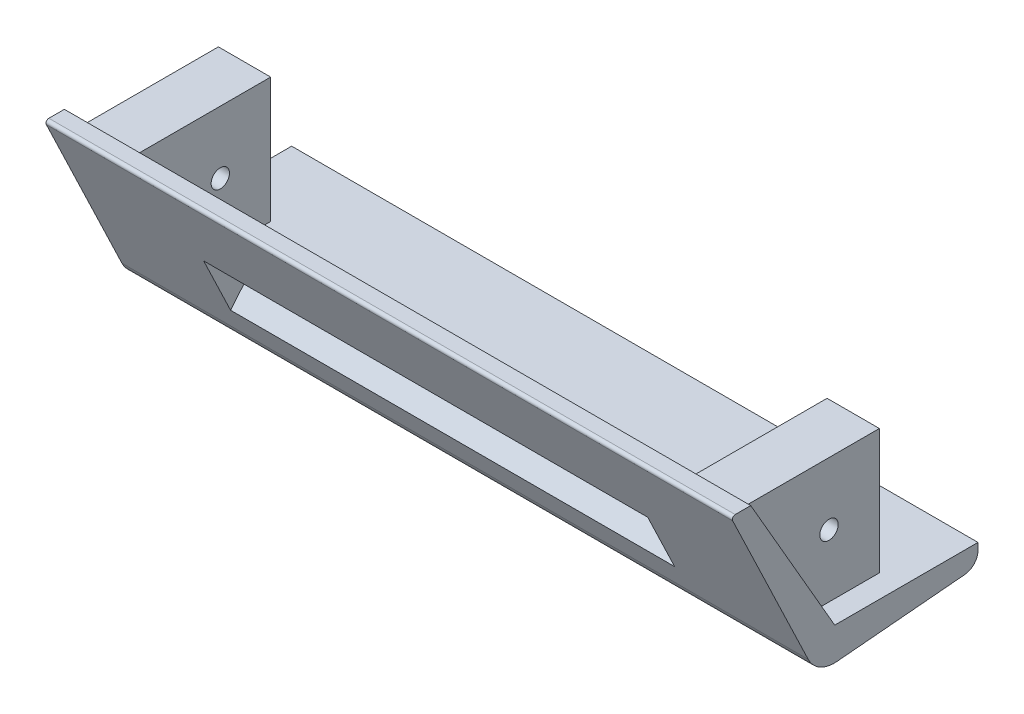
from build123d import *

# Parameters (mm, degrees)
BOSS_EXTRUDE2_DEPTH             = 119.775
BOSS_EXTRUDE1_REACH             = 141.38
SKETCH2_W                       = 18.25
SKETCH2_H                       = 43.65
BOSS_EXTRUDE1_DIRECTION_2_DEPTH = 20
CUT_EXTRUDE2_DEPTH              = 77.5
FILLET1_R                       = 10
FILLET2_R                       = 5
FILLET3_R                       = 1
CUT_EXTRUDE3_DEPTH              = 10
M6_CLEARANCE_HOLE1_D            = 6.4


with BuildPart() as part:
    # Sketch1 → Boss-Extrude2 (new, symmetric)
    with BuildSketch(Plane(origin=(0, 0, 0), x_dir=(0, 0, -1), z_dir=(1, 0, 0))):
        Polygon((0, 0), (-29.329393675, 50.8), (-36.329393675, 50.8), (-6.252899132, -12), (50, -7), (50, 0), align=None)
    extrude(amount=BOSS_EXTRUDE2_DEPTH, both=True)

    # Boss-Extrude1: up to this plane
    boss_extrude1_end = Plane(origin=(119.775, 0, 0), z_dir=(0, -0.5000000000000043, 0.8660254037844362))
    # Sketch2 → Boss-Extrude1 (add, up to the surface)
    with BuildSketch(Plane.XY, mode=Mode.PRIVATE) as boss_extrude1_sk1:
        with Locations((106.225, 25.4)):
            Rectangle(SKETCH2_W, SKETCH2_H)
    boss_extrude1_tool1 = split(extrude(boss_extrude1_sk1.sketch, amount=BOSS_EXTRUDE1_REACH, mode=Mode.PRIVATE), bisect_by=boss_extrude1_end, keep=Keep.BOTH, mode=Mode.PRIVATE)
    add(boss_extrude1_tool1.solids().sort_by_distance((106.225, 25.4, 0))[0])
    # Sketch2 → Boss-Extrude1 (add, up to the surface)
    with BuildSketch(Plane.XY, mode=Mode.PRIVATE) as boss_extrude1_sk2:
        with Locations((-106.225, 25.4)):
            Rectangle(SKETCH2_W, SKETCH2_H)
    boss_extrude1_tool2 = split(extrude(boss_extrude1_sk2.sketch, amount=BOSS_EXTRUDE1_REACH, mode=Mode.PRIVATE), bisect_by=boss_extrude1_end, keep=Keep.BOTH, mode=Mode.PRIVATE)
    add(boss_extrude1_tool2.solids().sort_by_distance((-106.225, 25.4, 0))[0])

    # Sketch2 → Boss-Extrude1 direction 2 (add)
    with BuildSketch(Plane.XY):
        with Locations((106.225, 25.4)):
            Rectangle(SKETCH2_W, SKETCH2_H)
        with Locations((-106.225, 25.4)):
            Rectangle(SKETCH2_W, SKETCH2_H)
    extrude(amount=-BOSS_EXTRUDE1_DIRECTION_2_DEPTH)

    # Sketch4 → Cut-Extrude2 (cut, symmetric)
    with BuildSketch(Plane(origin=(0, 0, 0), x_dir=(0, 0, -1), z_dir=(1, 0, 0))):
        Polygon((-23, 22.968102184), (-15.695479984, 27.185368782), (-6.695479984, 11.596911513), (-13.608418327, 3.358392408), align=None)
    extrude(amount=CUT_EXTRUDE2_DEPTH, both=True, mode=Mode.SUBTRACT)

    # Fillet1
    fillet1_edges = [part.edges().sort_by_distance(p)[0] for p in [
        (0, -12, 6.252899132),
    ]]
    fillet(fillet1_edges, radius=FILLET1_R)

    # Fillet2
    fillet2_edges = [part.edges().sort_by_distance(p)[0] for p in [
        (0, -7, -50),
    ]]
    fillet(fillet2_edges, radius=FILLET2_R)

    # Fillet3
    fillet3_edges = [part.edges().sort_by_distance(p)[0] for p in [
        (0, 50.8, 36.329393675),
    ]]
    fillet(fillet3_edges, radius=FILLET3_R)

    # Sketch8 → Cut-Extrude3 (cut)
    with BuildSketch(Plane.ZY.offset(-77.5)):
        with BuildLine():
            Line((15.695479984, 27.185368782), (18.293556195, 25.685368782))
            Line((18.293556195, 25.685368782), (10.293556195, 11.828962321))
            ThreePointArc((10.293556195, 11.828962321), (9.079143478, 10.897110668), (7.561505388, 11.096911513))
            Line((7.561505388, 11.096911513), (6.695479984, 11.596911513))
            Line((6.695479984, 11.596911513), (15.695479984, 27.185368782))
        make_face()
    extrude(amount=-CUT_EXTRUDE3_DEPTH, mode=Mode.SUBTRACT)

    # M6 Clearance Hole1 (through all)
    with Locations(Plane(origin=(115.35, 0, 0), x_dir=(0, 0, -1), z_dir=(1, 0, 0))):
        with Locations((2.420606325, 25.4)):
            Hole(M6_CLEARANCE_HOLE1_D / 2)


solid = part.part
